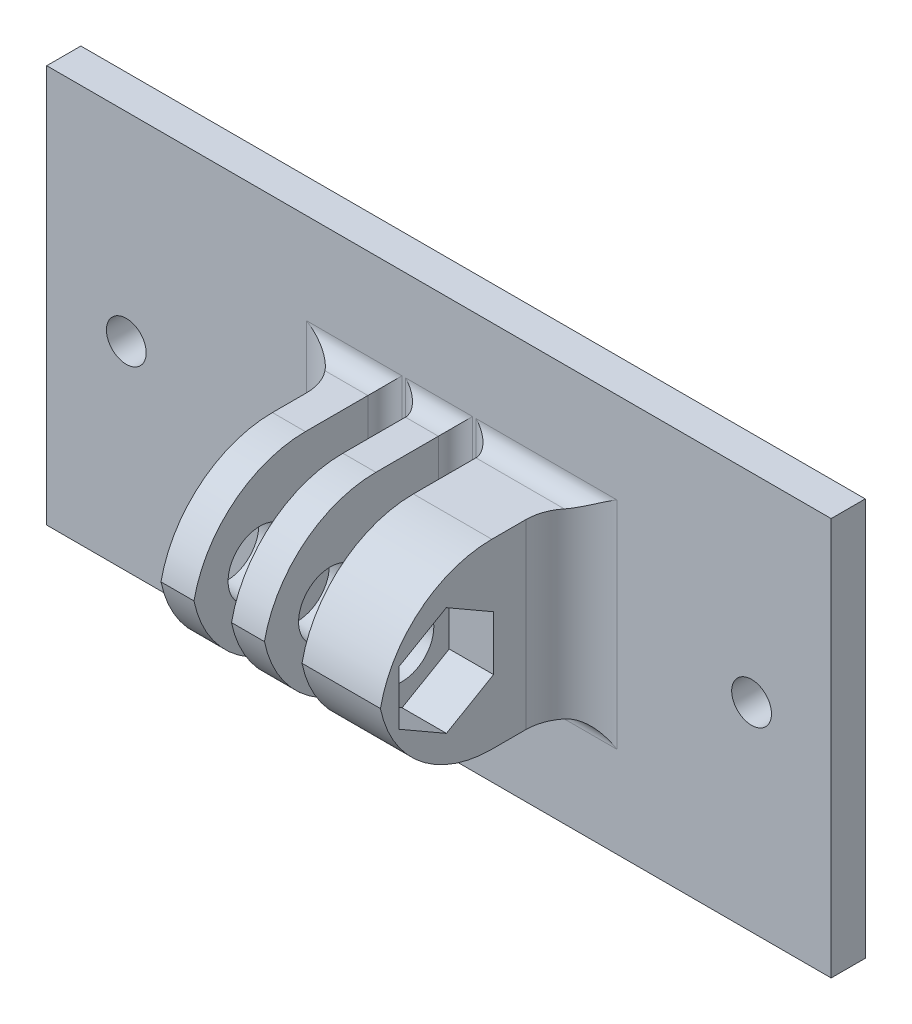
from build123d import *

# Parameters (mm, degrees)
SKETCH_1_W          = 69
SKETCH_1_H          = 35
EXTRUDE_1_DEPTH     = 3
SKETCH_2_W          = 2.9
SKETCH_2_H          = 16
SKETCH_2_W_2        = 6.9
EXTRUDE_2_DEPTH     = 17
CUT_EXTRUDE_1_REACH = 60.323
SKETCH_3_R          = 2.8
FILLET_1_R          = 10
FILLET_2_R          = 4
CUT_EXTRUDE_2_DEPTH = 10
FILLET_3_R          = 1.5
EXTRUDE_START       = -6.9
SKETCH_6_R          = 5.094551448
SKETCH_6_R_2        = 2.8
EXTRUDE_4_DEPTH     = 3
SKETCH_7_R          = 1.75
CUT_EXTRUDE_3_DEPTH = 10


with BuildPart() as part:
    # Эскиз1 → Бобышка-Вытянуть1 (new body)
    with BuildSketch(Plane.XY):
        with Locations((34.5, 17.5)):
            Rectangle(SKETCH_1_W, SKETCH_1_H)
    extrude(amount=EXTRUDE_1_DEPTH)

    # Эскиз2 → Бобышка-Вытянуть2 (add)
    with BuildSketch(Plane.XY.offset(3)):
        with Locations((34.5, 17.5)):
            Rectangle(SKETCH_2_W, SKETCH_2_H)
        with Locations((28.3, 17.5)):
            Rectangle(SKETCH_2_W, SKETCH_2_H)
        with Locations((42.7, 17.5)):
            Rectangle(SKETCH_2_W_2, SKETCH_2_H)
    extrude(amount=EXTRUDE_2_DEPTH)

    # Вырез-Вытянуть1: up to this face of the body (flat: up to its plane)
    cut_extrude_1_end = Plane(part.part.faces().sort_by_distance((35.95, 17.5, 11.5))[0])
    # Эскиз3 → Вырез-Вытянуть1 (cut, up to the picked face)
    with BuildSketch(Plane.ZY.offset(-26.85), mode=Mode.PRIVATE) as cut_extrude_1_sk1:
        with Locations((14, 17.5)):
            Circle(SKETCH_3_R)
    cut_extrude_1_tool1 = split(extrude(cut_extrude_1_sk1.sketch, amount=-CUT_EXTRUDE_1_REACH, mode=Mode.PRIVATE), bisect_by=cut_extrude_1_end, keep=Keep.BOTH, mode=Mode.PRIVATE)
    add(cut_extrude_1_tool1.solids().sort_by(Axis((26.85, 17.5, 14), (1, 0, 0)))[0], mode=Mode.SUBTRACT)

    # Скругление1
    # the kernel refuses this fillet: 10 mm, written as the material it takes off along each edge
    with BuildSketch(Plane(origin=(1.85, 25.5, 20), x_dir=(0, 0, -1), z_dir=(1, 0, 0)), Plane(origin=(54.75, 9.5, 20), x_dir=(0, 0, -1), z_dir=(-1, 0, 0))) as fillet_1_piece_1:
        with BuildLine():
            CenterArc((FILLET_1_R, -FILLET_1_R), FILLET_1_R, 90, 90)
            Line((0, -FILLET_1_R), (0, 0))
            Line((0, 0), (FILLET_1_R, 0))
        make_face()
    extrude(amount=52.9, mode=Mode.SUBTRACT)
    with BuildSketch(Plane(origin=(60.95, 25.5, 20), x_dir=(0, 0, -1), z_dir=(-1, 0, 0)), Plane(origin=(8.05, 9.5, 20), x_dir=(0, 0, -1), z_dir=(1, 0, 0))) as fillet_1_piece_2:
        with BuildLine():
            CenterArc((FILLET_1_R, FILLET_1_R), FILLET_1_R, 180, 90)
            Line((0, FILLET_1_R), (0, 0))
            Line((0, 0), (FILLET_1_R, 0))
        make_face()
    extrude(amount=52.9, mode=Mode.SUBTRACT)
    with BuildSketch(Plane(origin=(14.25, 25.5, 20), x_dir=(0, 0, -1), z_dir=(1, 0, 0)), Plane(origin=(71.15, 9.5, 20), x_dir=(0, 0, -1), z_dir=(-1, 0, 0))) as fillet_1_piece_3:
        with BuildLine():
            CenterArc((FILLET_1_R, -FILLET_1_R), FILLET_1_R, 90, 90)
            Line((0, -FILLET_1_R), (0, 0))
            Line((0, 0), (FILLET_1_R, 0))
        make_face()
    extrude(amount=56.9, mode=Mode.SUBTRACT)

    # Скругление2
    fillet_2_edges = [part.edges().sort_by_distance(p)[0] for p in [
        (46.15, 17.5, 3),
        (26.85, 17.5, 3),
    ]]
    fillet(fillet_2_edges, radius=FILLET_2_R)

    # Эскиз4 → Вырез-Вытянуть2 (cut)
    with BuildSketch(Plane.ZY.offset(-39.25)):
        Polygon((14.008077291, 22.292000427), (9.854044541, 19.902995352), (9.84596725, 15.110994925), (13.991922709, 12.707999573), (18.145955459, 15.097004648), (18.15403275, 19.889005075), align=None)
    extrude(amount=-CUT_EXTRUDE_2_DEPTH, mode=Mode.SUBTRACT)

    # Скругление3
    fillet_3_edges = [part.edges().sort_by_distance(p)[0] for p in [
        (34.5, 25.5, 3),
        (33.05, 17.5, 3),
        (34.5, 9.5, 3),
        (35.95, 17.5, 3),
        (39.25, 17.5, 3),
        (44.7, 9.5, 3),
        (44.7, 25.5, 3),
        (29.75, 17.5, 3),
        (26.3, 25.5, 3),
        (26.3, 9.5, 3),
    ]]
    fillet(fillet_3_edges, radius=FILLET_3_R)

    # Эскиз6 → Бобышка-Вытянуть4 (add)
    with BuildSketch(Plane(origin=(46.15, 0, 0), x_dir=(0, 0, -1), z_dir=(1, 0, 0)).offset(EXTRUDE_START)):
        with Locations((-14, 17.5)):
            Circle(SKETCH_6_R)
        with Locations(Location((-14, 17.5, 0), (0, 0, 180))):
            Circle(SKETCH_6_R_2, mode=Mode.SUBTRACT)
    extrude(amount=EXTRUDE_4_DEPTH)

    # Эскиз7 → Вырез-Вытянуть3 (cut)
    with BuildSketch(Plane.XY.offset(3)):
        with Locations((7, 17.5)):
            Circle(SKETCH_7_R)
        with Locations((62, 17.5)):
            Circle(SKETCH_7_R)
    extrude(amount=-CUT_EXTRUDE_3_DEPTH, mode=Mode.SUBTRACT)


solid = part.part
